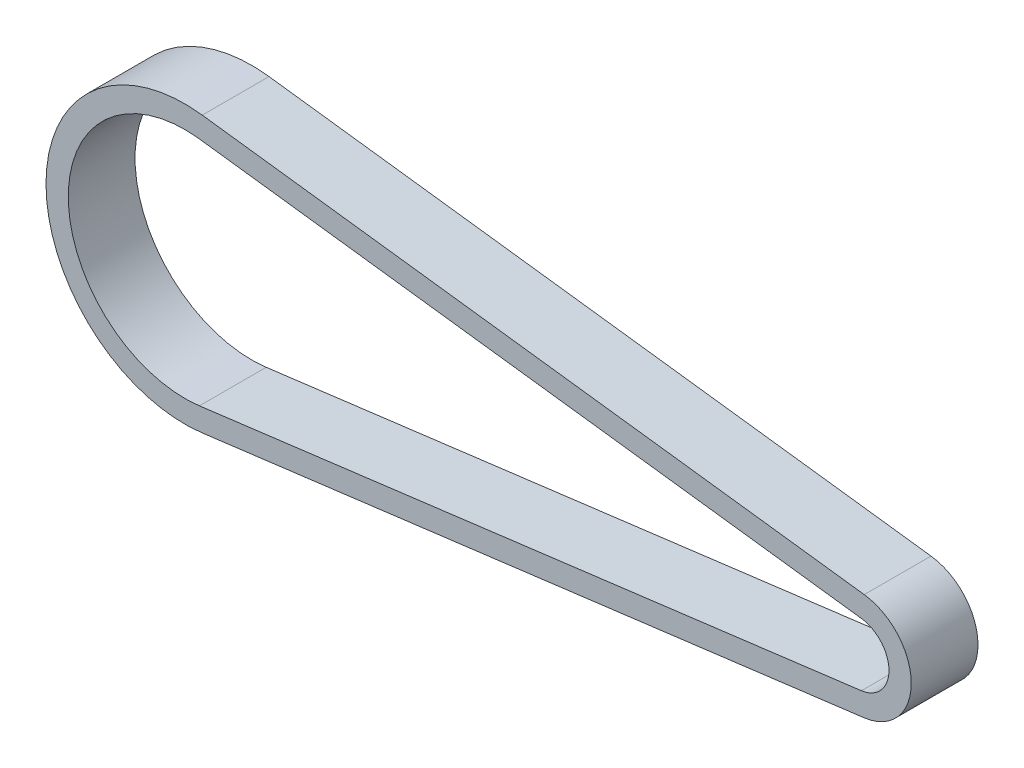
from build123d import *

# Parameters (mm, degrees)
RESSALTO_EXTRUS_O1_DEPTH = 4.5


with BuildPart() as part:
    # Esboço1 → Ressalto-extrusão1 (new, symmetric)
    with BuildSketch(Plane.XY):
        with BuildLine():
            ThreePointArc((2.361318902, 18.550314635), (-18.7, 0), (2.361318902, -18.550314635))
            Line((2.361318902, -18.550314635), (91.591504601, -7.191966904))
            ThreePointArc((91.591504601, -7.191966904), (97.92602, 0), (91.591504601, 7.191966904))
            Line((91.591504601, 7.191966904), (2.361318902, 18.550314635))
        make_face()
        with BuildLine():
            ThreePointArc((1.982497688, -15.57432833), (-15.7, 0), (1.982497688, 15.57432833))
            Line((1.982497688, 15.57432833), (91.212683387, 4.215980599))
            ThreePointArc((91.212683387, 4.215980599), (94.92602, 0), (91.212683387, -4.215980599))
            Line((91.212683387, -4.215980599), (1.982497688, -15.57432833))
        make_face(mode=Mode.SUBTRACT)
    extrude(amount=RESSALTO_EXTRUS_O1_DEPTH, both=True)


solid = part.part
